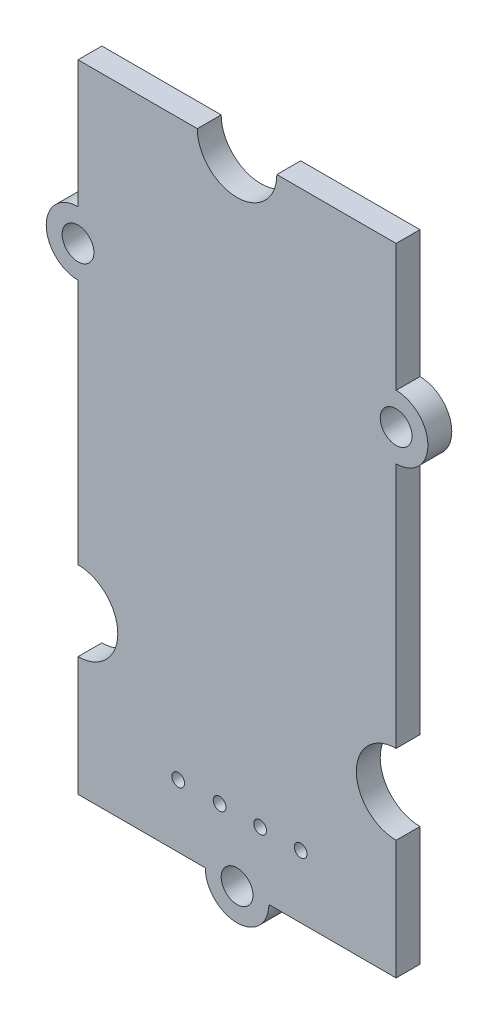
from build123d import *

# Parameters (mm, degrees)
PCB_DEPTH     = 1.5
ESQUISSE3_R   = 1
ESQUISSE3_R_2 = 0.4
TROUS_DEPTH   = 42.788156217


with BuildPart() as part:
    # Esquisse2 → PCB (new body)
    with BuildSketch(Plane.XY):
        with BuildLine():
            Line((-10, 0), (-2, 0))
            ThreePointArc((-2, 0), (0, -2), (2, 0))
            Line((2, 0), (10, 0))
            Line((10, 0), (10, 7.5))
            ThreePointArc((10, 7.5), (7.5, 10), (10, 12.5))
            Line((10, 12.5), (10, 28))
            ThreePointArc((10, 28), (12, 30), (10, 32))
            Line((10, 32), (10, 40))
            Line((10, 40), (2.5, 40))
            ThreePointArc((2.5, 40), (0, 37.5), (-2.5, 40))
            Line((-2.5, 40), (-10, 40))
            Line((-10, 40), (-10, 32))
            ThreePointArc((-10, 32), (-12, 30), (-10, 28))
            Line((-10, 28), (-10, 12.5))
            ThreePointArc((-10, 12.5), (-7.5, 10), (-10, 7.5))
            Line((-10, 7.5), (-10, 0))
        make_face()
    extrude(amount=PCB_DEPTH)

    # Esquisse3 → Trous (cut, through all)
    with BuildSketch(Plane.XY.offset(1.5)):
        with Locations((-10, 30)):
            Circle(ESQUISSE3_R)
        with Locations((4, 3.943417201)):
            Circle(ESQUISSE3_R_2)
        with Locations((10, 30)):
            Circle(ESQUISSE3_R)
        Circle(ESQUISSE3_R)
        with Locations((1.45, 3.943417201)):
            Circle(ESQUISSE3_R_2)
        with Locations((-1.1, 3.943417201)):
            Circle(ESQUISSE3_R_2)
        with Locations((-3.7, 3.943417201)):
            Circle(ESQUISSE3_R_2)
    extrude(amount=-TROUS_DEPTH, mode=Mode.SUBTRACT)


solid = part.part
